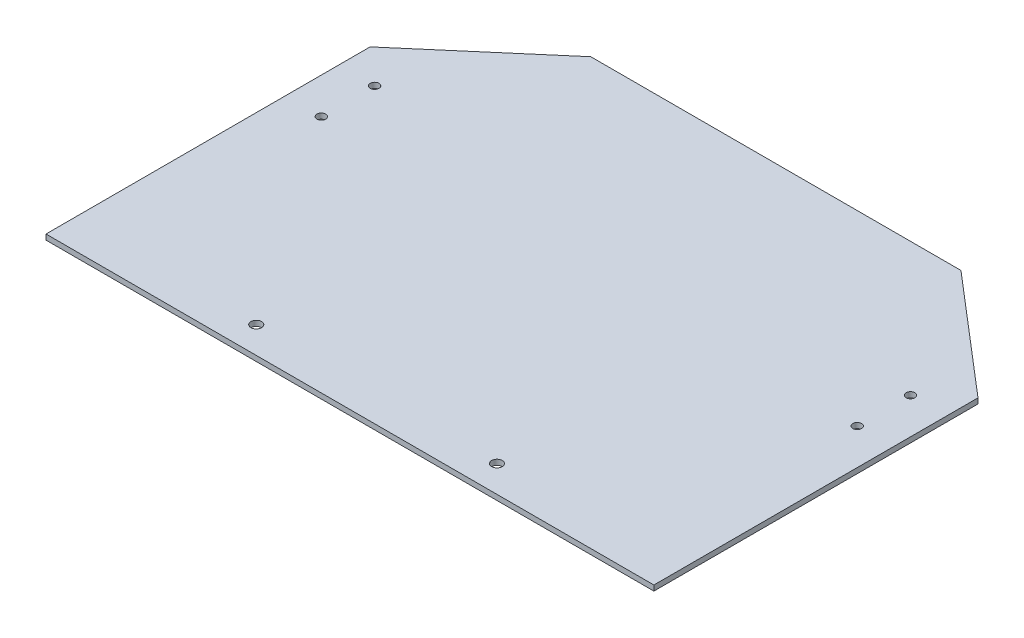
from build123d import *

# Parameters (mm, degrees)
RESSALTO_EXTRUS_O1_DEPTH = 2
ESBO_O3_R                = 2
CORTE_EXTRUS_O2_DEPTH    = 10
ESBO_O5_R                = 1.65
CORTE_EXTRUS_O5_DEPTH    = 2


with BuildPart() as part:
    # Esboço1 → Ressalto-extrusão1 (new body)
    with BuildSketch(Plane(origin=(0, 0, 0), x_dir=(1, 0, 0), z_dir=(0, 1, 0))):
        Polygon((-114, 41.685), (-114, -79.875), (114, -79.875), (114, 41.685), (69.415, 79.875), (-69.415, 79.875), align=None)
    extrude(amount=RESSALTO_EXTRUS_O1_DEPTH)

    # Esboço3 → Corte-extrusão2 (cut)
    with BuildSketch(Plane(origin=(0, 2, 0), x_dir=(1, 0, 0), z_dir=(0, 1, 0))):
        with Locations((-45.14, -69.875)):
            Circle(ESBO_O3_R)
        with Locations((45.14, -69.875)):
            Circle(ESBO_O3_R)
    extrude(amount=-CORTE_EXTRUS_O2_DEPTH, mode=Mode.SUBTRACT)

    # Esboço5 → Corte-extrusão5 (cut)
    with BuildSketch(Plane(origin=(0, 2, 0), x_dir=(1, 0, 0), z_dir=(0, 1, 0))):
        with Locations((100.5, 29.876998266)):
            Circle(ESBO_O5_R)
        with Locations((100.5, 9.876998266)):
            Circle(ESBO_O5_R)
        with Locations((-100.5, 29.876998266)):
            Circle(ESBO_O5_R)
        with Locations((-100.5, 9.876998266)):
            Circle(ESBO_O5_R)
    extrude(amount=-CORTE_EXTRUS_O5_DEPTH, mode=Mode.SUBTRACT)


solid = part.part
